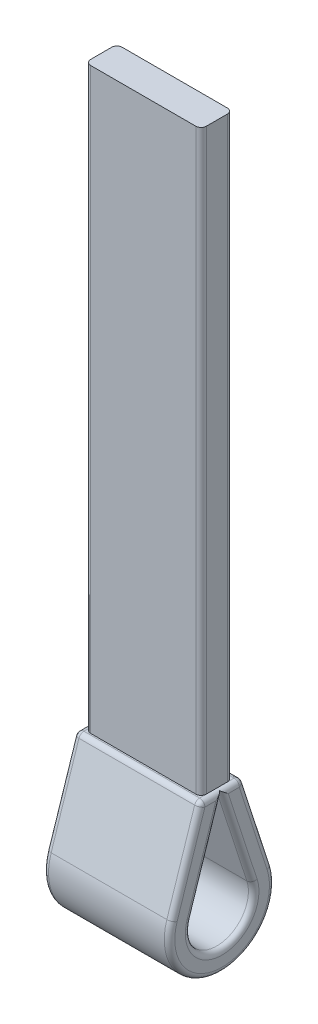
from build123d import *

# Parameters (mm, degrees)
BOSS_EXTRUDE1_DEPTH = 24
SKETCH2_W           = 24
SKETCH2_H           = 8
SKETCH2_W_2         = 22
SKETCH2_H_2         = 6
CUT_EXTRUDE1_DEPTH  = 40
FILLET1_R           = 1
FILLET2_R           = 1
BOSS_EXTRUDE2_DEPTH = 70


with BuildPart() as part:
    # Sketch1 → Boss-Extrude1 (new body)
    with BuildSketch(Plane(origin=(0, 0, 0), x_dir=(0, 0, -1), z_dir=(1, 0, 0))):
        with BuildLine():
            Line((-9.507879247, 3.098424151), (-4, 20))
            Line((-4, 20), (-4, 60))
            Line((-4, 60), (4, 60))
            Line((4, 60), (4, 20))
            Line((4, 20), (9.507879247, 3.098424151))
            ThreePointArc((9.507879247, 3.098424151), (0, -10), (-9.507879247, 3.098424151))
        make_face()
        with BuildLine():
            Line((-5.704727548, 1.85905449), (0, 19.364682524))
            Line((0, 19.364682524), (5.704727548, 1.85905449))
            ThreePointArc((5.704727548, 1.85905449), (0, -6), (-5.704727548, 1.85905449))
        make_face(mode=Mode.SUBTRACT)
    extrude(amount=BOSS_EXTRUDE1_DEPTH)

    # Sketch2 → Cut-Extrude1 (cut)
    with BuildSketch(Plane(origin=(0, 60, 0), x_dir=(1, 0, 0), z_dir=(0, 1, 0))):
        with Locations((12, 0)):
            Rectangle(SKETCH2_W, SKETCH2_H)
        with Locations((12, 0)):
            Rectangle(SKETCH2_W_2, SKETCH2_H_2, mode=Mode.SUBTRACT)
    extrude(amount=-CUT_EXTRUDE1_DEPTH, mode=Mode.SUBTRACT)

    # Fillet1
    # the kernel refuses this fillet: 1 mm, written as the material it takes off along each edge
    with BuildSketch(Plane(origin=(1, 19, 3.274120372), x_dir=(0, 0.3098424150516233, 0.9507879247418836), z_dir=(-1, 0, 0))) as fillet1_piece_1_section:
        Polygon((0, 0), (FILLET1_R * 1.02, 0), (FILLET1_R * 1.02, FILLET1_R * 0.740397220377), (FILLET1_R * 0.316039263353, FILLET1_R * 0.969803683237), align=None)
    fillet1_piece_1 = extrude(amount=FILLET1_R * 1.02, mode=Mode.PRIVATE)
    fillet1_piece_1 = fillet1_piece_1 - Plane(origin=(1, 19, 3.274120372), x_dir=(0, -0.8092720231948041, -0.5874340750026239), z_dir=(-1, 0, 0)) * Sphere(FILLET1_R, mode=Mode.PRIVATE)
    add(fillet1_piece_1, mode=Mode.SUBTRACT)
    with BuildSketch(Plane(origin=(23, 19, 3.274120372), x_dir=(0, 0.3098424150516233, 0.9507879247418836), z_dir=(1, 0, 0))) as fillet1_piece_2_section:
        Polygon((0, 0), (FILLET1_R * 1.02, 0), (FILLET1_R * 1.02, -FILLET1_R * 0.740397220377), (FILLET1_R * 0.316039263353, -FILLET1_R * 0.969803683237), align=None)
    fillet1_piece_2 = extrude(amount=FILLET1_R * 1.02, mode=Mode.PRIVATE)
    fillet1_piece_2 = fillet1_piece_2 - Plane(origin=(23, 19, 3.274120372), x_dir=(0, -0.8092720231948041, -0.5874340750026239), z_dir=(1, 0, 0)) * Sphere(FILLET1_R, mode=Mode.PRIVATE)
    add(fillet1_piece_2, mode=Mode.SUBTRACT)
    with BuildSketch(Plane(origin=(1, 19, -3.274120372), x_dir=(0, 0.3098424150516232, -0.9507879247418838), z_dir=(-1, 0, 0))) as fillet1_piece_3_section:
        Polygon((0, 0), (FILLET1_R * 1.02, 0), (FILLET1_R * 1.02, -FILLET1_R * 0.740397220377), (FILLET1_R * 0.316039263353, -FILLET1_R * 0.969803683237), align=None)
    fillet1_piece_3 = extrude(amount=FILLET1_R * 1.02, mode=Mode.PRIVATE)
    fillet1_piece_3 = fillet1_piece_3 - Plane(origin=(1, 19, -3.274120372), x_dir=(0, -0.8092720231948041, 0.587434075002624), z_dir=(-1, 0, 0)) * Sphere(FILLET1_R, mode=Mode.PRIVATE)
    add(fillet1_piece_3, mode=Mode.SUBTRACT)
    with BuildSketch(Plane(origin=(23, 19, -3.274120372), x_dir=(0, 0.3098424150516232, -0.9507879247418838), z_dir=(1, 0, 0))) as fillet1_piece_4_section:
        Polygon((0, 0), (FILLET1_R * 1.02, 0), (FILLET1_R * 1.02, FILLET1_R * 0.740397220377), (FILLET1_R * 0.316039263353, FILLET1_R * 0.969803683237), align=None)
    fillet1_piece_4 = extrude(amount=FILLET1_R * 1.02, mode=Mode.PRIVATE)
    fillet1_piece_4 = fillet1_piece_4 - Plane(origin=(23, 19, -3.274120372), x_dir=(0, -0.8092720231948041, 0.587434075002624), z_dir=(1, 0, 0)) * Sphere(FILLET1_R, mode=Mode.PRIVATE)
    add(fillet1_piece_4, mode=Mode.SUBTRACT)
    with BuildSketch(Plane(origin=(1, 20, 4), x_dir=(0, -0.9507879247418841, 0.30984241505162113), z_dir=(1, 0, 0)), Plane(origin=(1, 20, -4), x_dir=(0, 0, 1), z_dir=(1, 0, 0))) as fillet1_piece_5:
        with BuildLine():
            CenterArc((FILLET1_R * 0.725879627821, FILLET1_R), FILLET1_R, 198.04973395, 71.95026605)
            Line((-FILLET1_R * 0.224908296921, FILLET1_R * 0.690157584948), (-FILLET1_R * 0.243924055416, FILLET1_R * 0.683960736647))
            Line((-FILLET1_R * 0.243924055416, FILLET1_R * 0.683960736647), (-FILLET1_R * 0.0145175925564, -FILLET1_R * 0.02))
            Line((-FILLET1_R * 0.0145175925564, -FILLET1_R * 0.02), (FILLET1_R * 0.725879627821, -FILLET1_R * 0.02))
            Line((FILLET1_R * 0.725879627821, -FILLET1_R * 0.02), (FILLET1_R * 0.725879627821, 0))
        make_face()
    extrude(amount=22, mode=Mode.SUBTRACT)
    with BuildSketch(Plane(origin=(0, 0, 0), x_dir=(0, 0.3098424150516232, -0.9507879247418836), z_dir=(0, 0.9507879247418836, 0.3098424150516232))) as fillet1_piece_6:
        with BuildLine():
            CenterArc((6 + FILLET1_R, -FILLET1_R), FILLET1_R, 90, 90)
            Line((6, -FILLET1_R), (6 - FILLET1_R * 0.02, -FILLET1_R))
            Line((6 - FILLET1_R * 0.02, -FILLET1_R), (6 - FILLET1_R * 0.02, FILLET1_R * 0.02))
            Line((6 - FILLET1_R * 0.02, FILLET1_R * 0.02), (6 + FILLET1_R, FILLET1_R * 0.02))
            Line((6 + FILLET1_R, FILLET1_R * 0.02), (6 + FILLET1_R, 0))
        make_face()
    revolve(axis=Axis((0, 0, 0), (-1, 0, 0)), revolution_arc=216.0994679, mode=Mode.SUBTRACT)
    with BuildSketch(Plane(origin=(0, 21.741652336, 0.774606038), x_dir=(0, 0.30984241505162313, -0.9507879247418837), z_dir=(0, -0.9507879247418837, -0.30984241505162313))) as fillet1_piece_7_section:
        with BuildLine():
            CenterArc((FILLET1_R, FILLET1_R), FILLET1_R, 180, 90)
            Line((0, FILLET1_R), (-FILLET1_R * 0.02, FILLET1_R))
            Line((-FILLET1_R * 0.02, FILLET1_R), (-FILLET1_R * 0.02, -FILLET1_R * 0.02))
            Line((-FILLET1_R * 0.02, -FILLET1_R * 0.02), (FILLET1_R, -FILLET1_R * 0.02))
            Line((FILLET1_R, -FILLET1_R * 0.02), (FILLET1_R, 0))
        make_face()
    fillet1_piece_7 = extrude(amount=20.91170631, mode=Mode.PRIVATE)
    fillet1_piece_7 = split(fillet1_piece_7, bisect_by=Plane(origin=(0.224383955, 12.542231939, 2.223297658), z_dir=(0, -0.30984241505162313, -0.9507879247418837)), keep=Keep.TOP, mode=Mode.PRIVATE)
    add(fillet1_piece_7, mode=Mode.SUBTRACT)
    with BuildSketch(Plane(origin=(24, 3.098424151, 9.507879247), x_dir=(-1, 0, 0), z_dir=(0, 0.9507879247418836, -0.3098424150516233)), Plane(origin=(0, 19.309842415, -4.224908297), x_dir=(0, -0.3098424150516232, 0.9507879247418837), z_dir=(0, -0.9507879247418837, -0.3098424150516232))) as fillet1_piece_8:
        with BuildLine():
            CenterArc((FILLET1_R, -FILLET1_R), FILLET1_R, 90, 90)
            Line((0, -FILLET1_R), (-FILLET1_R * 0.02, -FILLET1_R))
            Line((-FILLET1_R * 0.02, -FILLET1_R), (-FILLET1_R * 0.02, FILLET1_R * 0.02))
            Line((-FILLET1_R * 0.02, FILLET1_R * 0.02), (FILLET1_R, FILLET1_R * 0.02))
            Line((FILLET1_R, FILLET1_R * 0.02), (FILLET1_R, 0))
        make_face()
    extrude(amount=17.050509207, mode=Mode.SUBTRACT)
    with BuildSketch(Plane(origin=(0, 1.85905449, 5.704727548), x_dir=(0, 0.3098424150516232, 0.9507879247418837), z_dir=(0, 0.9507879247418837, -0.30984241505162313))) as fillet1_piece_9_section:
        with BuildLine():
            CenterArc((FILLET1_R, FILLET1_R), FILLET1_R, 180, 90)
            Line((0, FILLET1_R), (-FILLET1_R * 0.02, FILLET1_R))
            Line((-FILLET1_R * 0.02, FILLET1_R), (-FILLET1_R * 0.02, -FILLET1_R * 0.02))
            Line((-FILLET1_R * 0.02, -FILLET1_R * 0.02), (FILLET1_R, -FILLET1_R * 0.02))
            Line((FILLET1_R, -FILLET1_R * 0.02), (FILLET1_R, 0))
        make_face()
    fillet1_piece_9 = extrude(amount=20.91170631, mode=Mode.PRIVATE)
    fillet1_piece_9 = split(fillet1_piece_9, bisect_by=Plane(origin=(0.224383955, 12.542231939, -2.223297658), z_dir=(0, -0.30984241505162313, 0.9507879247418837)), keep=Keep.TOP, mode=Mode.PRIVATE)
    add(fillet1_piece_9, mode=Mode.SUBTRACT)
    with BuildSketch(Plane(origin=(24, 0, 0), x_dir=(0, 0.3098424150516232, -0.9507879247418836), z_dir=(0, 0.9507879247418836, 0.3098424150516232))) as fillet1_piece_10:
        with BuildLine():
            CenterArc((6 + FILLET1_R, FILLET1_R), FILLET1_R, 180, 90)
            Line((6, FILLET1_R), (6 - FILLET1_R * 0.02, FILLET1_R))
            Line((6 - FILLET1_R * 0.02, FILLET1_R), (6 - FILLET1_R * 0.02, -FILLET1_R * 0.02))
            Line((6 - FILLET1_R * 0.02, -FILLET1_R * 0.02), (6 + FILLET1_R, -FILLET1_R * 0.02))
            Line((6 + FILLET1_R, -FILLET1_R * 0.02), (6 + FILLET1_R, 0))
        make_face()
    revolve(axis=Axis((24, 0, 0), (-1, 0, 0)), revolution_arc=216.0994679, mode=Mode.SUBTRACT)
    with BuildSketch(Plane(origin=(24, 21.741652336, 0.774606038), x_dir=(0, 0.30984241505162313, -0.9507879247418837), z_dir=(0, -0.9507879247418837, -0.30984241505162313))) as fillet1_piece_11_section:
        with BuildLine():
            CenterArc((FILLET1_R, -FILLET1_R), FILLET1_R, 90, 90)
            Line((0, -FILLET1_R), (-FILLET1_R * 0.02, -FILLET1_R))
            Line((-FILLET1_R * 0.02, -FILLET1_R), (-FILLET1_R * 0.02, FILLET1_R * 0.02))
            Line((-FILLET1_R * 0.02, FILLET1_R * 0.02), (FILLET1_R, FILLET1_R * 0.02))
            Line((FILLET1_R, FILLET1_R * 0.02), (FILLET1_R, 0))
        make_face()
    fillet1_piece_11 = extrude(amount=20.91170631, mode=Mode.PRIVATE)
    fillet1_piece_11 = split(fillet1_piece_11, bisect_by=Plane(origin=(23.775616045, 12.542231939, 2.223297658), z_dir=(0, -0.30984241505162313, -0.9507879247418837)), keep=Keep.TOP, mode=Mode.PRIVATE)
    add(fillet1_piece_11, mode=Mode.SUBTRACT)
    with BuildSketch(Plane(origin=(24, 1.85905449, 5.704727548), x_dir=(0, 0.3098424150516232, 0.9507879247418837), z_dir=(0, 0.9507879247418837, -0.30984241505162313))) as fillet1_piece_12_section:
        with BuildLine():
            CenterArc((FILLET1_R, -FILLET1_R), FILLET1_R, 90, 90)
            Line((0, -FILLET1_R), (-FILLET1_R * 0.02, -FILLET1_R))
            Line((-FILLET1_R * 0.02, -FILLET1_R), (-FILLET1_R * 0.02, FILLET1_R * 0.02))
            Line((-FILLET1_R * 0.02, FILLET1_R * 0.02), (FILLET1_R, FILLET1_R * 0.02))
            Line((FILLET1_R, FILLET1_R * 0.02), (FILLET1_R, 0))
        make_face()
    fillet1_piece_12 = extrude(amount=20.91170631, mode=Mode.PRIVATE)
    fillet1_piece_12 = split(fillet1_piece_12, bisect_by=Plane(origin=(23.775616045, 12.542231939, -2.223297658), z_dir=(0, -0.30984241505162313, 0.9507879247418837)), keep=Keep.TOP, mode=Mode.PRIVATE)
    add(fillet1_piece_12, mode=Mode.SUBTRACT)
    with BuildSketch(Plane(origin=(24, 20, 3.274120372), x_dir=(-1, 0, 0), z_dir=(0, 0, -1)), Plane(origin=(0, 20, -3.274120372), x_dir=(1, 0, 0), z_dir=(0, 0, 1))) as fillet1_piece_13:
        with BuildLine():
            CenterArc((FILLET1_R, -FILLET1_R), FILLET1_R, 90, 90)
            Line((0, -FILLET1_R), (-FILLET1_R * 0.02, -FILLET1_R))
            Line((-FILLET1_R * 0.02, -FILLET1_R), (-FILLET1_R * 0.02, FILLET1_R * 0.02))
            Line((-FILLET1_R * 0.02, FILLET1_R * 0.02), (FILLET1_R, FILLET1_R * 0.02))
            Line((FILLET1_R, FILLET1_R * 0.02), (FILLET1_R, 0))
        make_face()
    extrude(amount=6.548240744, mode=Mode.SUBTRACT)
    with BuildSketch(Plane(origin=(24, 0, 0), x_dir=(0, 0.3098424150516232, -0.9507879247418837), z_dir=(0, 0.9507879247418837, 0.3098424150516232))) as fillet1_piece_14:
        with BuildLine():
            CenterArc((10 - FILLET1_R, FILLET1_R), FILLET1_R, 270, 90)
            Line((10 - FILLET1_R, 0), (10 - FILLET1_R, -FILLET1_R * 0.02))
            Line((10 - FILLET1_R, -FILLET1_R * 0.02), (10 + FILLET1_R * 0.02, -FILLET1_R * 0.02))
            Line((10 + FILLET1_R * 0.02, -FILLET1_R * 0.02), (10 + FILLET1_R * 0.02, FILLET1_R))
            Line((10 + FILLET1_R * 0.02, FILLET1_R), (10, FILLET1_R))
        make_face()
    revolve(axis=Axis((24, 0, 0), (-1, 0, 0)), revolution_arc=216.0994679, mode=Mode.SUBTRACT)
    with BuildSketch(Plane(origin=(0, 3.098424151, 9.507879247), x_dir=(1, 0, 0), z_dir=(0, 0.9507879247418836, -0.3098424150516233)), Plane(origin=(24, 19.309842415, -4.224908297), x_dir=(0, -0.3098424150516232, 0.9507879247418837), z_dir=(0, -0.9507879247418837, -0.3098424150516232))) as fillet1_piece_15:
        with BuildLine():
            CenterArc((FILLET1_R, FILLET1_R), FILLET1_R, 180, 90)
            Line((0, FILLET1_R), (-FILLET1_R * 0.02, FILLET1_R))
            Line((-FILLET1_R * 0.02, FILLET1_R), (-FILLET1_R * 0.02, -FILLET1_R * 0.02))
            Line((-FILLET1_R * 0.02, -FILLET1_R * 0.02), (FILLET1_R, -FILLET1_R * 0.02))
            Line((FILLET1_R, -FILLET1_R * 0.02), (FILLET1_R, 0))
        make_face()
    extrude(amount=17.050509207, mode=Mode.SUBTRACT)
    with BuildSketch(Plane(origin=(0, 0, 0), x_dir=(0, 0.3098424150516232, -0.9507879247418837), z_dir=(0, 0.9507879247418837, 0.3098424150516232))) as fillet1_piece_16:
        with BuildLine():
            CenterArc((10 - FILLET1_R, -FILLET1_R), FILLET1_R, 0, 90)
            Line((10 - FILLET1_R, 0), (10 - FILLET1_R, FILLET1_R * 0.02))
            Line((10 - FILLET1_R, FILLET1_R * 0.02), (10 + FILLET1_R * 0.02, FILLET1_R * 0.02))
            Line((10 + FILLET1_R * 0.02, FILLET1_R * 0.02), (10 + FILLET1_R * 0.02, -FILLET1_R))
            Line((10 + FILLET1_R * 0.02, -FILLET1_R), (10, -FILLET1_R))
        make_face()
    revolve(axis=Axis((0, 0, 0), (-1, 0, 0)), revolution_arc=216.0994679, mode=Mode.SUBTRACT)
    with BuildSketch(Plane(origin=(0, 21.741652336, 0.774606038), x_dir=(0, 0.30984241505162313, -0.9507879247418837), z_dir=(0, -0.9507879247418837, -0.30984241505162313))) as fillet1_piece_17a_section:
        with BuildLine():
            CenterArc((FILLET1_R, FILLET1_R), FILLET1_R, 180, 90)
            Line((0, FILLET1_R), (-FILLET1_R * 0.02, FILLET1_R))
            Line((-FILLET1_R * 0.02, FILLET1_R), (-FILLET1_R * 0.02, -FILLET1_R * 0.02))
            Line((-FILLET1_R * 0.02, -FILLET1_R * 0.02), (FILLET1_R, -FILLET1_R * 0.02))
            Line((FILLET1_R, -FILLET1_R * 0.02), (FILLET1_R, 0))
        make_face()
    fillet1_piece_17a = extrude(amount=20.91170631, mode=Mode.PRIVATE)
    fillet1_piece_17a = split(fillet1_piece_17a, bisect_by=Plane(origin=(0.243592095, 20.539413838, -0.382821003), z_dir=(0, 0.30984241505162313, 0.9507879247418837)), keep=Keep.TOP, mode=Mode.PRIVATE)
    with BuildSketch(Plane(origin=(0, 1.85905449, 5.704727548), x_dir=(0, 0.3098424150516232, 0.9507879247418837), z_dir=(0, 0.9507879247418837, -0.30984241505162313))) as fillet1_piece_17b_section:
        with BuildLine():
            CenterArc((FILLET1_R, FILLET1_R), FILLET1_R, 180, 90)
            Line((0, FILLET1_R), (-FILLET1_R * 0.02, FILLET1_R))
            Line((-FILLET1_R * 0.02, FILLET1_R), (-FILLET1_R * 0.02, -FILLET1_R * 0.02))
            Line((-FILLET1_R * 0.02, -FILLET1_R * 0.02), (FILLET1_R, -FILLET1_R * 0.02))
            Line((FILLET1_R, -FILLET1_R * 0.02), (FILLET1_R, 0))
        make_face()
    fillet1_piece_17b = extrude(amount=20.91170631, mode=Mode.PRIVATE)
    fillet1_piece_17b = split(fillet1_piece_17b, bisect_by=Plane(origin=(0.243592095, 20.539413838, 0.382821003), z_dir=(0, 0.30984241505162313, -0.9507879247418837)), keep=Keep.TOP, mode=Mode.PRIVATE)
    fillet1_piece_17 = fillet1_piece_17a & fillet1_piece_17b
    add(fillet1_piece_17, mode=Mode.SUBTRACT)
    with BuildSketch(Plane(origin=(24, 21.741652336, 0.774606038), x_dir=(0, 0.30984241505162313, -0.9507879247418837), z_dir=(0, -0.9507879247418837, -0.30984241505162313))) as fillet1_piece_18a_section:
        with BuildLine():
            CenterArc((FILLET1_R, -FILLET1_R), FILLET1_R, 90, 90)
            Line((0, -FILLET1_R), (-FILLET1_R * 0.02, -FILLET1_R))
            Line((-FILLET1_R * 0.02, -FILLET1_R), (-FILLET1_R * 0.02, FILLET1_R * 0.02))
            Line((-FILLET1_R * 0.02, FILLET1_R * 0.02), (FILLET1_R, FILLET1_R * 0.02))
            Line((FILLET1_R, FILLET1_R * 0.02), (FILLET1_R, 0))
        make_face()
    fillet1_piece_18a = extrude(amount=20.91170631, mode=Mode.PRIVATE)
    fillet1_piece_18a = split(fillet1_piece_18a, bisect_by=Plane(origin=(23.756407905, 20.539413838, -0.382821003), z_dir=(0, 0.30984241505162313, 0.9507879247418837)), keep=Keep.TOP, mode=Mode.PRIVATE)
    with BuildSketch(Plane(origin=(24, 1.85905449, 5.704727548), x_dir=(0, 0.3098424150516232, 0.9507879247418837), z_dir=(0, 0.9507879247418837, -0.30984241505162313))) as fillet1_piece_18b_section:
        with BuildLine():
            CenterArc((FILLET1_R, -FILLET1_R), FILLET1_R, 90, 90)
            Line((0, -FILLET1_R), (-FILLET1_R * 0.02, -FILLET1_R))
            Line((-FILLET1_R * 0.02, -FILLET1_R), (-FILLET1_R * 0.02, FILLET1_R * 0.02))
            Line((-FILLET1_R * 0.02, FILLET1_R * 0.02), (FILLET1_R, FILLET1_R * 0.02))
            Line((FILLET1_R, FILLET1_R * 0.02), (FILLET1_R, 0))
        make_face()
    fillet1_piece_18b = extrude(amount=20.91170631, mode=Mode.PRIVATE)
    fillet1_piece_18b = split(fillet1_piece_18b, bisect_by=Plane(origin=(23.756407905, 20.539413838, 0.382821003), z_dir=(0, 0.30984241505162313, -0.9507879247418837)), keep=Keep.TOP, mode=Mode.PRIVATE)
    fillet1_piece_18 = fillet1_piece_18a & fillet1_piece_18b
    add(fillet1_piece_18, mode=Mode.SUBTRACT)

    # Fillet2
    fillet2_edges = [part.edges().sort_by_distance(p)[0] for p in [
        (23, 40, -3),
        (23, 40, 3),
        (1, 40, 3),
        (1, 40, -3),
    ]]
    fillet(fillet2_edges, radius=FILLET2_R)

    # Sketch3 → Boss-Extrude2 (add)
    with BuildSketch(Plane(origin=(0, 60, 0), x_dir=(1, 0, 0), z_dir=(0, 1, 0))):
        with BuildLine():
            Line((22, 3), (2, 3))
            ThreePointArc((2, 3), (1.292893219, 2.707106781), (1, 2))
            Line((1, 2), (1, -2))
            ThreePointArc((1, -2), (1.292893219, -2.707106781), (2, -3))
            Line((2, -3), (22, -3))
            ThreePointArc((22, -3), (22.707106781, -2.707106781), (23, -2))
            Line((23, -2), (23, 2))
            ThreePointArc((23, 2), (22.707106781, 2.707106781), (22, 3))
        make_face()
    extrude(amount=BOSS_EXTRUDE2_DEPTH)


solid = part.part
